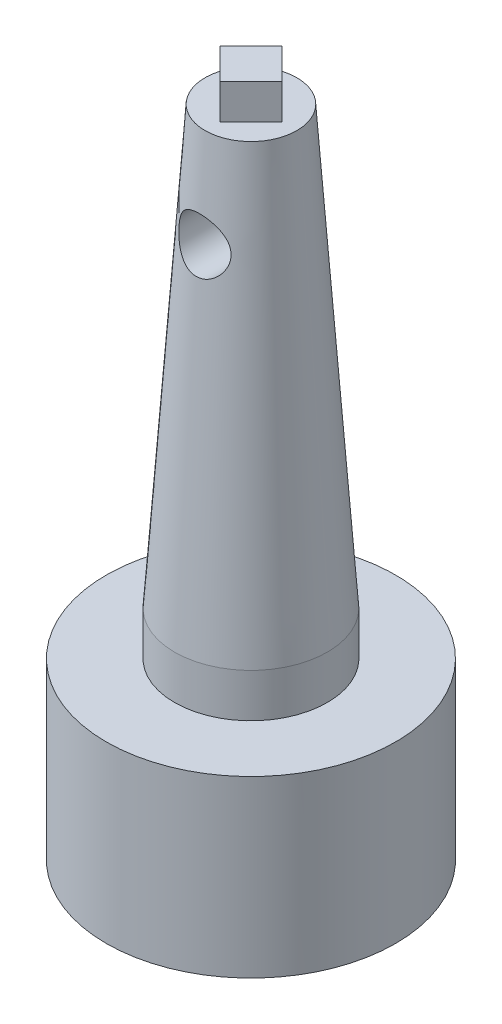
from build123d import *

# Parameters (mm, degrees)
SKETCH1_R           = 33.14
BOSS_EXTRUDE7_DEPTH = 40
SKETCH4_R           = 17.5
CUT_EXTRUDE1_DEPTH  = 5
BOSS_EXTRUDE9_DEPTH = 8
SKETCH7_R           = 6
CUT_EXTRUDE2_DEPTH  = 178.288271755


# Read off the part's stored shape, not the designer's step: Boss-Extrude8
with BuildPart() as part:
    # Sketch1 → Boss-Extrude7 (new body)
    with BuildSketch(Plane(origin=(0, 0, 0), x_dir=(1, 0, 0), z_dir=(0, 1, 0))):
        with Locations(Location((0, 0, 0), (0, 0, 270))):
            Circle(SKETCH1_R)
    extrude(amount=BOSS_EXTRUDE7_DEPTH)

    # Sketch2 → Cut-Revolve1 (revolve, cut)
    with BuildSketch(Plane.XY):
        with BuildLine():
            Line((0, 33.14), (0, 0))
            Line((0, 0), (33.14, 0))
            ThreePointArc((33.14, 0), (23.433518729, 23.433518729), (0, 33.14))
        make_face()
    revolve(axis=Axis((0, 33.14, 0), (0, -1, 0)), mode=Mode.SUBTRACT)

    # Sketch4 → Cut-Extrude1 (cut)
    with BuildSketch(Plane(origin=(0, 40, 0), x_dir=(1, 0, 0), z_dir=(0, 1, 0))):
        with Locations(Location((0, 0, 0), (0, 0, 270))):
            Circle(SKETCH4_R)
    extrude(amount=-CUT_EXTRUDE1_DEPTH, mode=Mode.SUBTRACT)

    # Boss-Extrude8 outline → Boss-Extrude8 (revolve)
    with BuildSketch(Plane.XY):
        Polygon((17.5, 35), (17.5, 50), (10.507318806, 150), (0, 150), (0, 35), align=None)
    revolve(axis=Axis((0, 0, 0), (0, 1, 0)))

    # Sketch6 → Boss-Extrude9 (add)
    with BuildSketch(Plane(origin=(0, 150, 0), x_dir=(1, 0, 0), z_dir=(0, 1, 0))):
        Polygon((0, 7.07), (-7.072135463, 0), (0, -7.07), (7.072135463, 0), align=None)
    extrude(amount=BOSS_EXTRUDE9_DEPTH)

    # Sketch7 → Cut-Extrude2 (cut, through all)
    with BuildSketch(Plane(origin=(-0.293937447, 0, 39.998930323), x_dir=(0.9999729998922554, 0, 0.007348434287890893), z_dir=(-0.007348434287890893, -1.1102230246251565e-15, 0.9999729998922554))):
        with Locations(Location((0, 128, 0), (0, 0, 270.874748169))):
            Circle(SKETCH7_R)
    extrude(amount=-CUT_EXTRUDE2_DEPTH, mode=Mode.SUBTRACT)


solid = part.part
